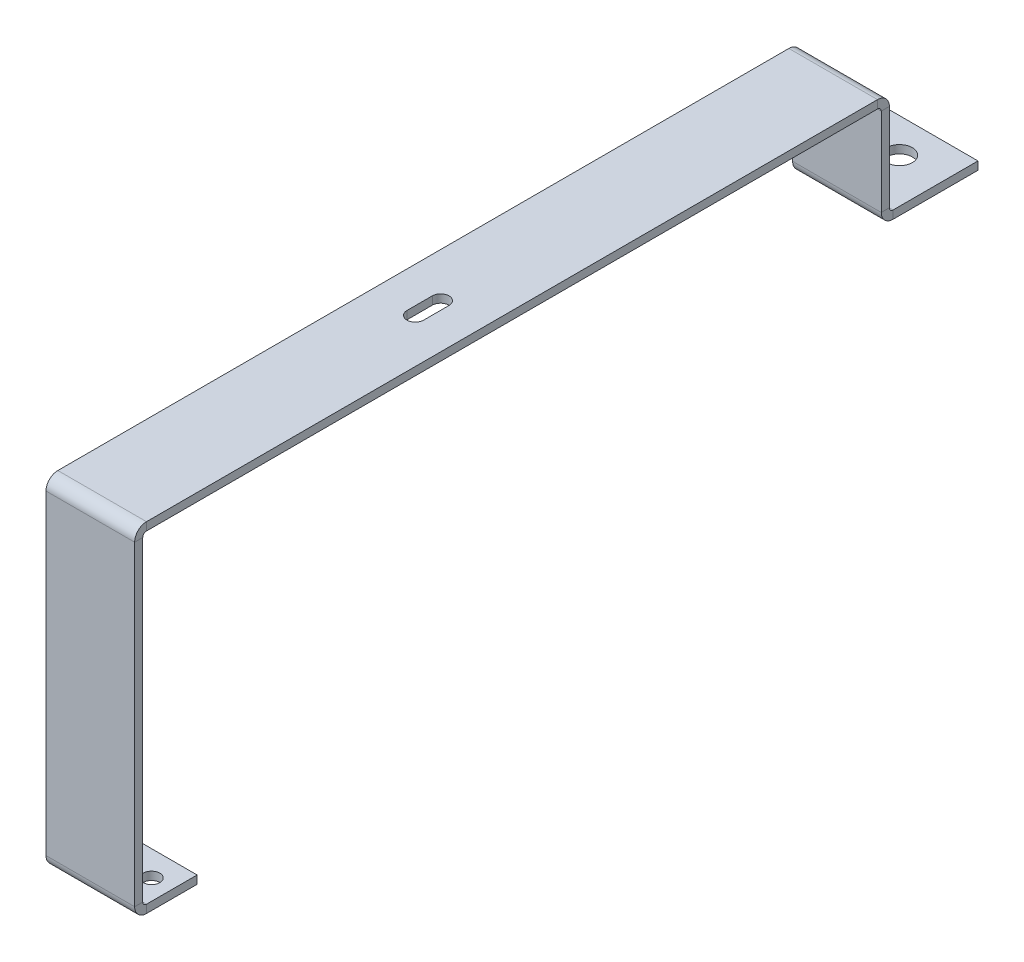
from build123d import *

# Parameters (mm, degrees)
SKETCH1_W                    = 17.5
SKETCH1_H                    = 10
BASE_FLANGE1_DEPTH           = 1.6
EDGE_FLANGE1_DEPTH           = 17.5
EDGE_FLANGE2_STRIP_W         = 7.8732
EDGE_FLANGE2_STRIP_H         = 1.6
EDGE_FLANGE2_STRIP_CUT_DEPTH = 17.5
EDGE_FLANGE2_DEPTH           = 17.5
EDGE_FLANGE3_STRIP_W         = 7.8732
EDGE_FLANGE3_STRIP_H         = 1.6
EDGE_FLANGE3_STRIP_CUT_DEPTH = 17.5
EDGE_FLANGE3_DEPTH           = 17.5
F_4_CLEARANCE_HOLE1_D        = 3.2639
F_4_CLEARANCE_HOLE1_DEPTH    = 1.6
F_4_CLEARANCE_HOLE1_TIP      = 0.980574487
CUT_EXTRUDE3_DEPTH           = 1.6
EDGE_FLANGE4_STRIP_W         = 7.8732
EDGE_FLANGE4_STRIP_H         = 1.6
EDGE_FLANGE4_STRIP_CUT_DEPTH = 17.5
EDGE_FLANGE4_DEPTH           = 17.5
F_10_CLEARANCE_HOLE1_D       = 5.1054
F_10_CLEARANCE_HOLE1_DEPTH   = 7.6
F_10_CLEARANCE_HOLE1_TIP     = 1.533816902


# Sheet-metal steps are written as plain solids
with BuildPart() as part:
    # Sketch1 → Base-Flange1 (new body)
    with BuildSketch(Plane(origin=(0, 0, 0), x_dir=(1, 0, 0), z_dir=(0, 1, 0))):
        Rectangle(SKETCH1_W, SKETCH1_H)
    extrude(amount=BASE_FLANGE1_DEPTH)

    # Edge-Flange1 section (across the edge) → Edge-Flange1 (add)
    with BuildSketch(Plane(origin=(-8.75, 1.6, 5.7366), x_dir=(0, 0, -1), z_dir=(1, 0, 0))):
        with BuildLine():
            Line((-1.6, 0.7366), (-1.6, 65.4))
            Line((-1.6, 65.4), (0, 65.4))
            Line((0, 65.4), (0, 0.7366))
            ThreePointArc((0, 0.7366), (0.215745145, 0.215745145), (0.7366, 0))
            Line((0.7366, 0), (0.7366, -1.6))
            ThreePointArc((0.7366, -1.6), (-0.915625705, -0.915625705), (-1.6, 0.7366))
        make_face()
    extrude(amount=EDGE_FLANGE1_DEPTH)

    # Edge-Flange2 strip (across the edge) → Edge-Flange2 strip cut (cut)
    with BuildSketch(Plane(origin=(-8.75, 67, 5.7366), x_dir=(0, -1, 0), z_dir=(1, 0, 0))):
        with Locations((-1.6, -0.8)):
            Rectangle(EDGE_FLANGE2_STRIP_W, EDGE_FLANGE2_STRIP_H)
    extrude(amount=EDGE_FLANGE2_STRIP_CUT_DEPTH, mode=Mode.SUBTRACT)

    # Edge-Flange2 section (across the edge) → Edge-Flange2 (add)
    with BuildSketch(Plane(origin=(-8.75, 67, 5.7366), x_dir=(0, -1, 0), z_dir=(1, 0, 0))):
        with BuildLine():
            Line((0, 0.7366), (0, 147.4))
            Line((0, 147.4), (1.6, 147.4))
            Line((1.6, 147.4), (1.6, 0.7366))
            ThreePointArc((1.6, 0.7366), (1.815745145, 0.215745145), (2.3366, 0))
            Line((2.3366, 0), (2.3366, -1.6))
            ThreePointArc((2.3366, -1.6), (0.684374295, -0.915625705), (0, 0.7366))
        make_face()
    extrude(amount=EDGE_FLANGE2_DEPTH)

    # Edge-Flange3 strip (across the edge) → Edge-Flange3 strip cut (cut)
    with BuildSketch(Plane(origin=(-8.75, 65.4, -141.6634), x_dir=(0, 0, 1), z_dir=(1, 0, 0))):
        with Locations((-1.6, -0.8)):
            Rectangle(EDGE_FLANGE3_STRIP_W, EDGE_FLANGE3_STRIP_H)
    extrude(amount=EDGE_FLANGE3_STRIP_CUT_DEPTH, mode=Mode.SUBTRACT)

    # Edge-Flange3 section (across the edge) → Edge-Flange3 (add)
    with BuildSketch(Plane(origin=(-8.75, 65.4, -141.6634), x_dir=(0, 0, 1), z_dir=(1, 0, 0))):
        with BuildLine():
            Line((0, 0.7366), (0, 20.4))
            Line((0, 20.4), (1.6, 20.4))
            Line((1.6, 20.4), (1.6, 0.7366))
            ThreePointArc((1.6, 0.7366), (1.815745145, 0.215745145), (2.3366, 0))
            Line((2.3366, 0), (2.3366, -1.6))
            ThreePointArc((2.3366, -1.6), (0.684374295, -0.915625705), (0, 0.7366))
        make_face()
    extrude(amount=EDGE_FLANGE3_DEPTH)

    # #4 Clearance Hole1
    with Locations(Plane.XZ):
        with Locations((4.75, 0), (-4.75, 0)):
            Hole(F_4_CLEARANCE_HOLE1_D / 2, depth=F_4_CLEARANCE_HOLE1_DEPTH)
            with Locations((0, 0, -(F_4_CLEARANCE_HOLE1_DEPTH + F_4_CLEARANCE_HOLE1_TIP / 2))):  # 118° drill point
                Cone(0, F_4_CLEARANCE_HOLE1_D / 2, F_4_CLEARANCE_HOLE1_TIP, mode=Mode.SUBTRACT)

    # Sketch23 → Cut-Extrude3 (cut)
    with BuildSketch(Plane.XZ.offset(-65.4)):
        with BuildLine():
            Line((-1.65, -61.8268), (-1.65, -56.8268))
            ThreePointArc((-1.65, -56.8268), (0, -55.1768), (1.65, -56.8268))
            Line((1.65, -56.8268), (1.65, -61.8268))
            ThreePointArc((1.65, -61.8268), (0, -63.4768), (-1.65, -61.8268))
        make_face()
    extrude(amount=-CUT_EXTRUDE3_DEPTH, mode=Mode.SUBTRACT)

    # Edge-Flange4 strip (across the edge) → Edge-Flange4 strip cut (cut)
    with BuildSketch(Plane(origin=(8.75, 45, -141.6634), x_dir=(0, 1, 0), z_dir=(-1, 0, 0))):
        with Locations((-1.6, -0.8)):
            Rectangle(EDGE_FLANGE4_STRIP_W, EDGE_FLANGE4_STRIP_H)
    extrude(amount=EDGE_FLANGE4_STRIP_CUT_DEPTH, mode=Mode.SUBTRACT)

    # Edge-Flange4 section (across the edge) → Edge-Flange4 (add)
    with BuildSketch(Plane(origin=(8.75, 45, -141.6634), x_dir=(0, 1, 0), z_dir=(-1, 0, 0))):
        with BuildLine():
            Line((0, 0.7366), (0, 17.5))
            Line((0, 17.5), (1.6, 17.5))
            Line((1.6, 17.5), (1.6, 0.7366))
            ThreePointArc((1.6, 0.7366), (1.815745145, 0.215745145), (2.3366, 0))
            Line((2.3366, 0), (2.3366, -1.6))
            ThreePointArc((2.3366, -1.6), (0.684374295, -0.915625705), (0, 0.7366))
        make_face()
    extrude(amount=EDGE_FLANGE4_DEPTH)

    # #10 Clearance Hole1
    with Locations(Plane(origin=(0, 46.6, 0), x_dir=(1, 0, 0), z_dir=(0, 1, 0))):
        with Locations((0, 152.4)):
            Hole(F_10_CLEARANCE_HOLE1_D / 2, depth=F_10_CLEARANCE_HOLE1_DEPTH)
            with Locations((0, 0, -(F_10_CLEARANCE_HOLE1_DEPTH + F_10_CLEARANCE_HOLE1_TIP / 2))):  # 118° drill point
                Cone(0, F_10_CLEARANCE_HOLE1_D / 2, F_10_CLEARANCE_HOLE1_TIP, mode=Mode.SUBTRACT)


solid = part.part
